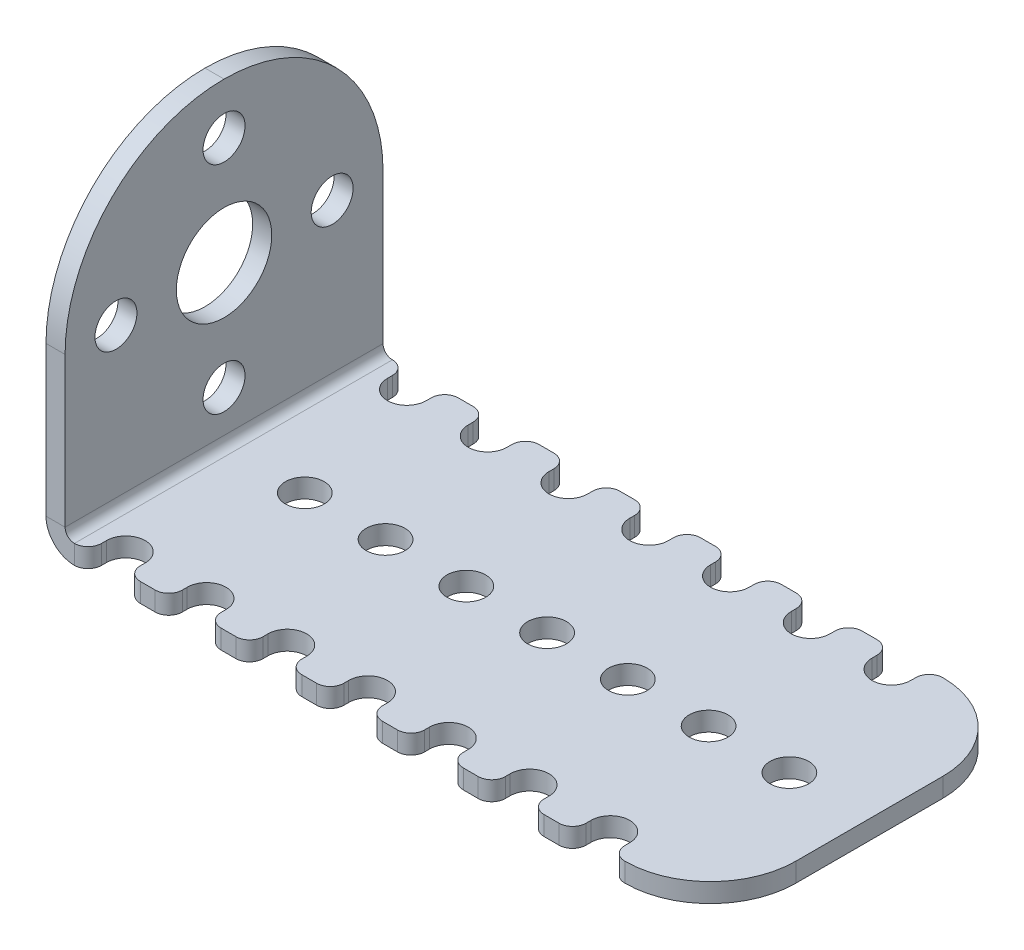
from build123d import *

# Parameters (mm, degrees)
SKETCH1_W          = 50
SKETCH1_H          = 25
BASE_FLANGE1_DEPTH = 1.5
EDGE_FLANGE1_DEPTH = 25
FILLET1_R          = 12.5
CUT_EXTRUDE1_REACH = 61.245
SKETCH11_R         = 3.75
SKETCH11_R_2       = 1.65
CUT_EXTRUDE2_START = -1.5
SKETCH14_R         = 1.524
CUT_EXTRUDE2_DEPTH = 26.5


# Sheet-metal steps are written as plain solids
with BuildPart() as part:
    # Sketch1 → Base-Flange1 (new body)
    with BuildSketch(Plane(origin=(0, 0, 0), x_dir=(1, 0, 0), z_dir=(0, 1, 0))):
        Rectangle(SKETCH1_W, SKETCH1_H)
    extrude(amount=-BASE_FLANGE1_DEPTH)

    # Edge-Flange1 section (across the edge) → Edge-Flange1 (add)
    with BuildSketch(Plane(origin=(-25.7366, 0, -12.5), x_dir=(1, 0, 0), z_dir=(0, 0, 1))):
        with BuildLine():
            Line((-1.5, 0.7366), (-1.5, 25))
            Line((-1.5, 25), (0, 25))
            Line((0, 25), (0, 0.7366))
            ThreePointArc((0, 0.7366), (0.215745145, 0.215745145), (0.7366, 0))
            Line((0.7366, 0), (0.7366, -1.5))
            ThreePointArc((0.7366, -1.5), (-0.844915027, -0.844915027), (-1.5, 0.7366))
        make_face()
    extrude(amount=EDGE_FLANGE1_DEPTH)

    # Fillet1
    fillet1_edges = [part.edges().sort_by_distance(p)[0] for p in [
        (-26.4866, 25, -12.5),
        (-26.4866, 25, 12.5),
    ]]
    fillet(fillet1_edges, radius=FILLET1_R - 0.0001)  # a hair under: the kernel refuses the full size

    # Sketch11 → Cut-Extrude1 (cut, up to next)
    with BuildSketch(Plane.ZY.offset(27.2366), mode=Mode.PRIVATE) as cut_extrude1_sk1:
        with Locations(Location((0, 12.5, 0), (0, 0, 270))):
            Circle(SKETCH11_R)
    cut_extrude1_tool1 = extrude(cut_extrude1_sk1.sketch, amount=-CUT_EXTRUDE1_REACH, mode=Mode.PRIVATE) & part.part
    # Sketch11 → Cut-Extrude1 (cut, up to next)
    with BuildSketch(Plane.ZY.offset(27.2366), mode=Mode.PRIVATE) as cut_extrude1_sk2:
        with Locations(Location((0, 21, 0), (0, 0, 270))):
            Circle(SKETCH11_R_2)
    cut_extrude1_tool2 = extrude(cut_extrude1_sk2.sketch, amount=-CUT_EXTRUDE1_REACH, mode=Mode.PRIVATE) & part.part
    # Sketch11 → Cut-Extrude1 (cut, up to next)
    with BuildSketch(Plane.ZY.offset(27.2366), mode=Mode.PRIVATE) as cut_extrude1_sk3:
        with Locations(Location((8.5, 12.5, 0), (0, 0, 270))):
            Circle(SKETCH11_R_2)
    cut_extrude1_tool3 = extrude(cut_extrude1_sk3.sketch, amount=-CUT_EXTRUDE1_REACH, mode=Mode.PRIVATE) & part.part
    # Sketch11 → Cut-Extrude1 (cut, up to next)
    with BuildSketch(Plane.ZY.offset(27.2366), mode=Mode.PRIVATE) as cut_extrude1_sk4:
        with Locations(Location((0, 4, 0), (0, 0, 270))):
            Circle(SKETCH11_R_2)
    cut_extrude1_tool4 = extrude(cut_extrude1_sk4.sketch, amount=-CUT_EXTRUDE1_REACH, mode=Mode.PRIVATE) & part.part
    # Sketch11 → Cut-Extrude1 (cut, up to next)
    with BuildSketch(Plane.ZY.offset(27.2366), mode=Mode.PRIVATE) as cut_extrude1_sk5:
        with Locations(Location((-8.5, 12.5, 0), (0, 0, 270))):
            Circle(SKETCH11_R_2)
    cut_extrude1_tool5 = extrude(cut_extrude1_sk5.sketch, amount=-CUT_EXTRUDE1_REACH, mode=Mode.PRIVATE) & part.part
    add(cut_extrude1_tool1.solids().sort_by_distance((-27.2366, 12.5, 0))[0], mode=Mode.SUBTRACT)
    add(cut_extrude1_tool2.solids().sort_by_distance((-27.2366, 21, 0))[0], mode=Mode.SUBTRACT)
    add(cut_extrude1_tool3.solids().sort_by_distance((-27.2366, 12.5, 8.5))[0], mode=Mode.SUBTRACT)
    add(cut_extrude1_tool4.solids().sort_by_distance((-27.2366, 4, 0))[0], mode=Mode.SUBTRACT)
    add(cut_extrude1_tool5.solids().sort_by_distance((-27.2366, 12.5, -8.5))[0], mode=Mode.SUBTRACT)

    # Sketch14 → Cut-Extrude2 (cut)
    with BuildSketch(Plane(origin=(0, 0, 0), x_dir=(1, 0, 0), z_dir=(0, 1, 0)).offset(CUT_EXTRUDE2_START)):
        with Locations(Location((-19.3866, 0, 0), (0, 0, 270))):
            Circle(SKETCH14_R)
        with Locations(Location((-13.0366, 0, 0), (0, 0, 270))):
            Circle(SKETCH14_R)
        with Locations(Location((-6.6866, 0, 0), (0, 0, 270))):
            Circle(SKETCH14_R)
        with Locations(Location((-0.3366, 0, 0), (0, 0, 270))):
            Circle(SKETCH14_R)
        with Locations(Location((6.0134, 0, 0), (0, 0, 270))):
            Circle(SKETCH14_R)
        with Locations(Location((12.3634, 0, 0), (0, 0, 270))):
            Circle(SKETCH14_R)
        with Locations(Location((18.7134, 0, 0), (0, 0, 270))):
            Circle(SKETCH14_R)
        with BuildLine():
            Line((-20.8866, 11.049), (-20.8866, 11.4346))
            ThreePointArc((-20.8866, 11.4346), (-20.574551565, 12.187951565), (-19.8212, 12.5))
            Line((-19.8212, 12.5), (-18.65, 12.5))
            ThreePointArc((-18.65, 12.5), (-17.896648435, 12.187951565), (-17.5846, 11.4346))
            Line((-17.5846, 11.4346), (-17.5846, 11.049))
            ThreePointArc((-17.5846, 11.049), (-16.0606, 9.525), (-14.5366, 11.049))
            Line((-14.5366, 11.049), (-14.5366, 11.4346))
            ThreePointArc((-14.5366, 11.4346), (-14.224551565, 12.187951565), (-13.4712, 12.5))
            Line((-13.4712, 12.5), (-12.3, 12.5))
            ThreePointArc((-12.3, 12.5), (-11.546648435, 12.187951565), (-11.2346, 11.4346))
            Line((-11.2346, 11.4346), (-11.2346, 11.049))
            ThreePointArc((-11.2346, 11.049), (-9.7106, 9.525), (-8.1866, 11.049))
            Line((-8.1866, 11.049), (-8.1866, 11.4346))
            ThreePointArc((-8.1866, 11.4346), (-7.874551565, 12.187951565), (-7.1212, 12.5))
            Line((-7.1212, 12.5), (-5.95, 12.5))
            ThreePointArc((-5.95, 12.5), (-5.196648435, 12.187951565), (-4.8846, 11.4346))
            Line((-4.8846, 11.4346), (-4.8846, 11.049))
            ThreePointArc((-4.8846, 11.049), (-3.3606, 9.525), (-1.8366, 11.049))
            Line((-1.8366, 11.049), (-1.8366, 11.4346))
            ThreePointArc((-1.8366, 11.4346), (-1.524551565, 12.187951565), (-0.7712, 12.5))
            Line((-0.7712, 12.5), (0.4, 12.5))
            ThreePointArc((0.4, 12.5), (1.153351565, 12.187951565), (1.4654, 11.4346))
            Line((1.4654, 11.4346), (1.4654, 11.049))
            ThreePointArc((1.4654, 11.049), (2.9894, 9.525), (4.5134, 11.049))
            Line((4.5134, 11.049), (4.5134, 11.4346))
            ThreePointArc((4.5134, 11.4346), (4.825448435, 12.187951565), (5.5788, 12.5))
            Line((5.5788, 12.5), (6.75, 12.5))
            ThreePointArc((6.75, 12.5), (7.503351565, 12.187951565), (7.8154, 11.4346))
            Line((7.8154, 11.4346), (7.8154, 11.049))
            ThreePointArc((7.8154, 11.049), (9.3394, 9.525), (10.8634, 11.049))
            Line((10.8634, 11.049), (10.8634, 11.4346))
            ThreePointArc((10.8634, 11.4346), (11.175448435, 12.187951565), (11.9288, 12.5))
            Line((11.9288, 12.5), (13.1, 12.5))
            ThreePointArc((13.1, 12.5), (13.853351565, 12.187951565), (14.1654, 11.4346))
            Line((14.1654, 11.4346), (14.1654, 11.049))
            ThreePointArc((14.1654, 11.049), (15.6894, 9.525), (17.2134, 11.049))
            Line((17.2134, 11.049), (17.2134, 11.4346))
            ThreePointArc((17.2134, 11.4346), (17.525448435, 12.187951565), (18.2788, 12.5))
            ThreePointArc((18.2788, 12.5), (23.031406098, 10.531406098), (25, 5.7788))
            Line((25, 5.7788), (25, 3.086206539))
            Line((25, 3.086206539), (30.090944924, 3.086206539))
            Line((30.090944924, 3.086206539), (30.090944924, 14.304286601))
            Line((30.090944924, 14.304286601), (18.2788, 14.304286601))
            Line((18.2788, 14.304286601), (-25, 14.304286601))
            Line((-25, 14.304286601), (-25, 12.5))
            ThreePointArc((-25, 12.5), (-24.246648435, 12.187951565), (-23.9346, 11.4346))
            Line((-23.9346, 11.4346), (-23.9346, 11.049))
            ThreePointArc((-23.9346, 11.049), (-22.4106, 9.525), (-20.8866, 11.049))
        make_face()
        with BuildLine():
            Line((30.090944924, -14.304286601), (18.2788, -14.304286601))
            Line((18.2788, -14.304286601), (-25, -14.304286601))
            Line((-25, -14.304286601), (-25, -12.5))
            ThreePointArc((-25, -12.5), (-24.246648435, -12.187951565), (-23.9346, -11.4346))
            Line((-23.9346, -11.4346), (-23.9346, -11.049))
            ThreePointArc((-23.9346, -11.049), (-22.4106, -9.525), (-20.8866, -11.049))
            Line((-20.8866, -11.049), (-20.8866, -11.4346))
            ThreePointArc((-20.8866, -11.4346), (-20.574551565, -12.187951565), (-19.8212, -12.5))
            Line((-19.8212, -12.5), (-18.65, -12.5))
            ThreePointArc((-18.65, -12.5), (-17.896648435, -12.187951565), (-17.5846, -11.4346))
            Line((-17.5846, -11.4346), (-17.5846, -11.049))
            ThreePointArc((-17.5846, -11.049), (-16.0606, -9.525), (-14.5366, -11.049))
            Line((-14.5366, -11.049), (-14.5366, -11.4346))
            ThreePointArc((-14.5366, -11.4346), (-14.224551565, -12.187951565), (-13.4712, -12.5))
            Line((-13.4712, -12.5), (-12.3, -12.5))
            ThreePointArc((-12.3, -12.5), (-11.546648435, -12.187951565), (-11.2346, -11.4346))
            Line((-11.2346, -11.4346), (-11.2346, -11.049))
            ThreePointArc((-11.2346, -11.049), (-9.7106, -9.525), (-8.1866, -11.049))
            Line((-8.1866, -11.049), (-8.1866, -11.4346))
            ThreePointArc((-8.1866, -11.4346), (-7.874551565, -12.187951565), (-7.1212, -12.5))
            Line((-7.1212, -12.5), (-5.95, -12.5))
            ThreePointArc((-5.95, -12.5), (-5.196648435, -12.187951565), (-4.8846, -11.4346))
            Line((-4.8846, -11.4346), (-4.8846, -11.049))
            ThreePointArc((-4.8846, -11.049), (-3.3606, -9.525), (-1.8366, -11.049))
            Line((-1.8366, -11.049), (-1.8366, -11.4346))
            ThreePointArc((-1.8366, -11.4346), (-1.524551565, -12.187951565), (-0.7712, -12.5))
            Line((-0.7712, -12.5), (0.4, -12.5))
            ThreePointArc((0.4, -12.5), (1.153351565, -12.187951565), (1.4654, -11.4346))
            Line((1.4654, -11.4346), (1.4654, -11.049))
            ThreePointArc((1.4654, -11.049), (2.9894, -9.525), (4.5134, -11.049))
            Line((4.5134, -11.049), (4.5134, -11.4346))
            ThreePointArc((4.5134, -11.4346), (4.825448435, -12.187951565), (5.5788, -12.5))
            Line((5.5788, -12.5), (6.75, -12.5))
            ThreePointArc((6.75, -12.5), (7.503351565, -12.187951565), (7.8154, -11.4346))
            Line((7.8154, -11.4346), (7.8154, -11.049))
            ThreePointArc((7.8154, -11.049), (9.3394, -9.525), (10.8634, -11.049))
            Line((10.8634, -11.049), (10.8634, -11.4346))
            ThreePointArc((10.8634, -11.4346), (11.175448435, -12.187951565), (11.9288, -12.5))
            Line((11.9288, -12.5), (13.1, -12.5))
            ThreePointArc((13.1, -12.5), (13.853351565, -12.187951565), (14.1654, -11.4346))
            Line((14.1654, -11.4346), (14.1654, -11.049))
            ThreePointArc((14.1654, -11.049), (15.6894, -9.525), (17.2134, -11.049))
            Line((17.2134, -11.049), (17.2134, -11.4346))
            ThreePointArc((17.2134, -11.4346), (17.525448435, -12.187951565), (18.2788, -12.5))
            ThreePointArc((18.2788, -12.5), (23.031406098, -10.531406098), (25, -5.7788))
            Line((25, -5.7788), (25, -3.086206539))
            Line((25, -3.086206539), (30.090944924, -3.086206539))
            Line((30.090944924, -3.086206539), (30.090944924, -14.304286601))
        make_face()
    extrude(amount=CUT_EXTRUDE2_DEPTH, mode=Mode.SUBTRACT)


solid = part.part
